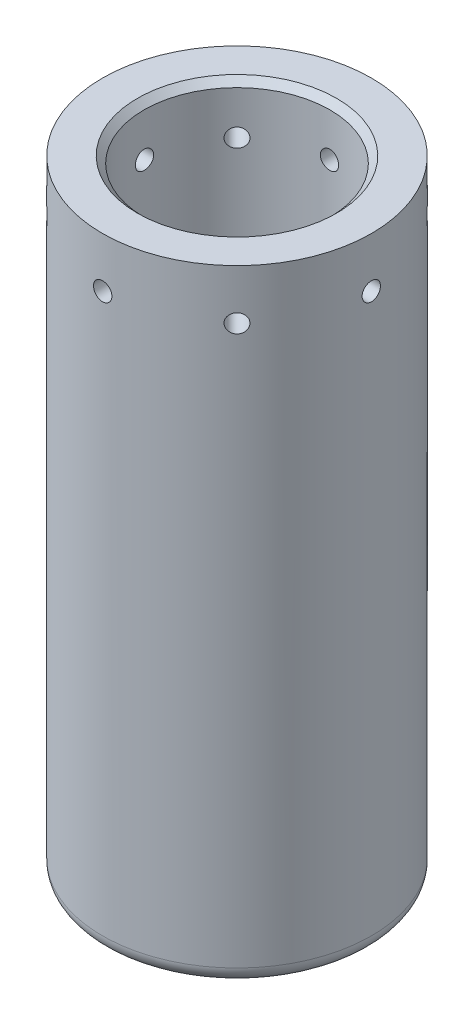
from build123d import *

# Parameters (mm, degrees)
SKETCH1_R           = 16.15
SKETCH1_R_2         = 11.15
BOSS_EXTRUDE1_DEPTH = 70
BOSS_EXTRUDE2_START = 5
SKETCH2_R           = 16.15
BOSS_EXTRUDE2_DEPTH = 5
CHAMFER1_SIZE       = 5
FILLET1_R           = 2
CHAMFER2_SIZE       = 0.8
SKETCH3_R           = 1.1
CUT_EXTRUDE1_DEPTH  = 10
CIRPATTERN1_COUNT   = 8


with BuildPart() as part:
    # Sketch1 → Boss-Extrude1 (new body)
    with BuildSketch(Plane(origin=(0, 0, 0), x_dir=(1, 0, 0), z_dir=(0, 1, 0))):
        Circle(SKETCH1_R)
        Circle(SKETCH1_R_2, mode=Mode.SUBTRACT)
    extrude(amount=BOSS_EXTRUDE1_DEPTH)

    # Sketch2 → Boss-Extrude2 (add)
    with BuildSketch(Plane.XZ.offset(BOSS_EXTRUDE2_START)):
        Circle(SKETCH2_R)
    extrude(amount=-BOSS_EXTRUDE2_DEPTH)

    # Chamfer1
    chamfer1_edges = [part.edges().sort_by_distance(p)[0] for p in [
        (-11.15, 0, 0),
    ]]
    chamfer(chamfer1_edges, length=CHAMFER1_SIZE)

    # Fillet1
    fillet1_edges = [part.edges().sort_by_distance(p)[0] for p in [
        (-16.15, -5, 0),
    ]]
    fillet(fillet1_edges, radius=FILLET1_R)

    # Chamfer2
    chamfer2_edges = [part.edges().sort_by_distance(p)[0] for p in [
        (-11.15, 70, 0),
    ]]
    chamfer(chamfer2_edges, length=CHAMFER2_SIZE)

    # Sketch3 → Cut-Extrude1 (cut)
    with BuildSketch(Plane(origin=(16.15, 0, 0), x_dir=(0, 0, -1), z_dir=(1, 0, 0))):
        with Locations((0, 64)):
            Circle(SKETCH3_R)
    cut_extrude1 = extrude(amount=-CUT_EXTRUDE1_DEPTH, mode=Mode.SUBTRACT)

    # CirPattern1: Cut-Extrude1 ×8 about axis
    cirpattern1_axis = Axis((0, 69.2, 0), (0, -1, 0))
    for i in range(1, CIRPATTERN1_COUNT):
        add(cut_extrude1.rotate(cirpattern1_axis, i * 360 / CIRPATTERN1_COUNT), mode=Mode.SUBTRACT)


solid = part.part
